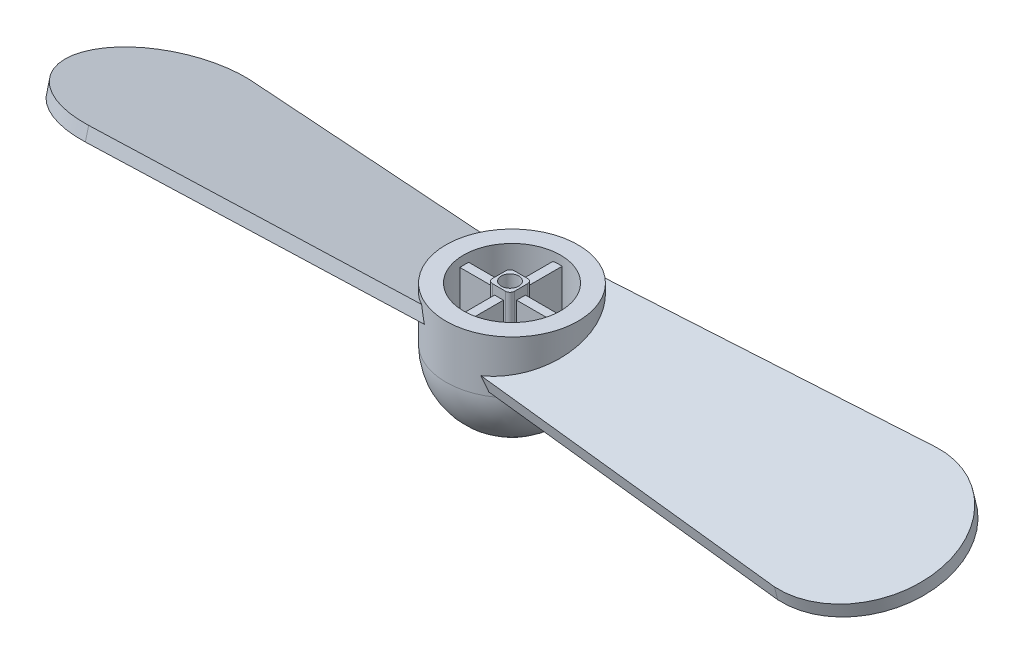
from build123d import *

# Parameters (mm, degrees)
SKETCH_1_R               = 7.5
EXTRUDE_1_DEPTH          = 6
EXTRUDE_2_DEPTH          = 50
EXTRUDE_3_DEPTH          = 1.5
CUT_EXTRUDE_START        = -1.5
CUT_EXTRUDE_2_DEPTH      = 1.475557967
PATTERN_CIRCULAR_1_COUNT = 2
REVOLVE_1_ANGLE          = 180
EXTRUDE_5_REACH          = 54.77
SKETCH_8_W               = 2.5
SKETCH_8_H               = 2.5
EXTRUDE_6_REACH          = 55.77
EXTRUDE_START            = -1
SKETCH_14_W              = 6.185620564
SKETCH_14_H              = 1
EXTRUDE_7_REACH          = 54.523
SKETCH_15_W              = 1
SKETCH_15_H              = 5.873847005
FILLET_1_R               = 0.5
SKETCH_16_R              = 1
CUT_EXTRUDE_5_DEPTH      = 7


# Read off the part's stored shape, not the designer's step: 切除-拉伸2, 抽壳9
with BuildPart() as part:
    # 草图1 → 凸台-拉伸1 (new body)
    with BuildSketch(Plane(origin=(0, 0, 0), x_dir=(1, 0, 0), z_dir=(0, 1, 0))):
        with Locations(Location((0.301002806, -0.075250701, 0), (0, 0, 270))):
            Circle(SKETCH_1_R)
    extrude(amount=EXTRUDE_1_DEPTH)

    # 草图2 → 凸台-拉伸2 (add)
    with BuildSketch(Plane(origin=(0, 0, 0), x_dir=(0, 0, -1), z_dir=(1, 0, 0))):
        Polygon((-6.841656071, 1.896781733), (-6.217832024, 0.532654335), (6.742880936, 3.816427212), (6.11905689, 5.18055461), align=None)
    extrude(amount=EXTRUDE_2_DEPTH)

    # 草图3 → 凸台-拉伸3 (add)
    with BuildSketch(Plane(origin=(0, 3.411230811, 0.864281714), x_dir=(1, 0, 0), z_dir=(0, 0.9693704528417939, 0.24560318637447578))):
        with BuildLine():
            Line((3.425595735, 7.47367623), (3.536085243, -6.166243606))
            Line((3.536085243, -6.166243606), (40.104138222, -9.535908549))
            ThreePointArc((40.104138222, -9.535908549), (50, -0.119655983), (40.104138222, 9.296596584))
            Line((40.104138222, 9.296596584), (3.425595735, 7.47367623))
        make_face()
    extrude_3 = extrude(amount=-EXTRUDE_3_DEPTH)

    # 切除-拉伸2 outline → 切除-拉伸2 (cut)
    with BuildSketch(Plane(origin=(0, 1.957175132, 0.495876935), x_dir=(1, 0, 0), z_dir=(0, -0.9693704528417938, -0.24560318637447576)).offset(CUT_EXTRUDE_START)):
        with BuildLine():
            Line((59.770521771, 9.535908549), (41.04011208, 9.535908549))
            ThreePointArc((41.04011208, 9.535908549), (47.402093905, 6.618605973), (50, 0.119655983))
            ThreePointArc((50, 0.119655983), (47.402093905, -6.379294008), (41.040112081, -9.296596584))
            Line((41.040112081, -9.296596584), (60.303287448, -9.296596584))
            Line((60.303287448, -9.296596584), (59.770521771, 9.535908549))
        make_face()
    extrude(amount=CUT_EXTRUDE_2_DEPTH, mode=Mode.SUBTRACT)

    # 阵列(圆周)1: 凸台-拉伸3 ×2 about axis
    pattern_circular_1_axis = Axis((0.301002806, 0, 0.075250701), (0, 1, 0))
    for i in range(1, PATTERN_CIRCULAR_1_COUNT):
        add(extrude_3.rotate(pattern_circular_1_axis, i * 360 / PATTERN_CIRCULAR_1_COUNT))

    # 草图6 → 旋转1 (revolve)
    with BuildSketch(Plane(origin=(0, 0, 0), x_dir=(1, 0, 0), z_dir=(0, 1, 0))):
        with BuildLine():
            Line((7.577071557, -1.894267889), (-6.975065945, 1.743766486))
            ThreePointArc((-6.975065945, 1.743766486), (2.120019994, 7.20081805), (7.577071557, -1.894267889))
        make_face()
    revolve(axis=Axis((7.577071557, 0, 1.894267889), (-0.9701425001453376, 0, -0.2425356250363098)), revolution_arc=REVOLVE_1_ANGLE)

    # 抽壳9 outline → 抽壳9 (revolve, cut)
    with BuildSketch(Plane(origin=(0.301002806, 0, 0.075250701), x_dir=(1, 0, 0), z_dir=(0, 0, 1))):
        with BuildLine():
            Line((5.5, 6e-09), (5.5, 6))
            Line((5.5, 6), (0, 6))
            Line((0, 6), (0, -5.5))
            ThreePointArc((0, -5.5), (3.889087299, -3.889087294), (5.5, 6e-09))
        make_face()
    revolve(axis=Axis((0.301002806, 0, 0.075250701), (0, 1, 0)), mode=Mode.SUBTRACT)

    # 草图8 → 凸台-拉伸5 (add, up to next)
    with BuildSketch(Plane(origin=(0, 6, 0), x_dir=(1, 0, 0), z_dir=(0, 1, 0)), mode=Mode.PRIVATE) as extrude_5_sk1:
        Rectangle(SKETCH_8_W, SKETCH_8_H)
    extrude_5_tool1 = extrude(extrude_5_sk1.sketch, amount=-EXTRUDE_5_REACH, mode=Mode.PRIVATE) - part.part
    add(extrude_5_tool1.solids().sort_by_distance((0, 6, 0))[0])

    # 草图14 → 凸台-拉伸6 (add, up to next)
    with BuildSketch(Plane(origin=(0, 6, 0), x_dir=(1, 0, 0), z_dir=(0, 1, 0)).offset(EXTRUDE_START), mode=Mode.PRIVATE) as extrude_6_sk1:
        with Locations((3.092810282, 0)):
            Rectangle(SKETCH_14_W, SKETCH_14_H)
    extrude_6_tool1 = extrude(extrude_6_sk1.sketch, amount=-EXTRUDE_6_REACH, mode=Mode.PRIVATE) - part.part
    extrude_6 = extrude_6_tool1.solids().sort_by_distance((3.09281, 5, 0))[0]
    add(extrude_6)

    # 镜向1: 凸台-拉伸6 across plane
    add(extrude_6.mirror(Plane(origin=(0, 0, 0), x_dir=(0, 0, 1), z_dir=(1, 0, 0))))

    # 草图15 → 凸台-拉伸7 (add, up to next)
    with BuildSketch(Plane(origin=(0, 5, 0), x_dir=(1, 0, 0), z_dir=(0, 1, 0)), mode=Mode.PRIVATE) as extrude_7_sk1:
        with Locations((0, 2.936923503)):
            Rectangle(SKETCH_15_W, SKETCH_15_H)
    extrude_7_tool1 = extrude(extrude_7_sk1.sketch, amount=-EXTRUDE_7_REACH, mode=Mode.PRIVATE) - part.part
    extrude_7 = extrude_7_tool1.solids().sort_by_distance((0, 5, -2.936924))[0]
    add(extrude_7)

    # 镜向2: 凸台-拉伸7 mirrored; each copy of 凸台-拉伸7 runs up to whatever stops it at its own place
    mirror_2_before = part.part  # the part as the pattern finds it: every copy runs up to it
    mirror_2_extrude_7_long = extrude(extrude_7_sk1.sketch, amount=-EXTRUDE_7_REACH, mode=Mode.PRIVATE)
    mirror_2_extrude_7_tool1 = mirror_2_extrude_7_long.mirror(Plane.XY) - mirror_2_before
    add(mirror_2_extrude_7_tool1.solids().sort_by_distance((0, 5, 2.936924))[0])

    # 圆角1
    fillet_1_edges = [part.edges().sort_by_distance(p)[0] for p in [
        (-1.25, 0.427824152, 1.25),
        (1.25, 0.355696292, 1.25),
        (1.25, 0.373542552, -1.25),
        (-1.25, 0.446174395, -1.25),
    ]]
    fillet(fillet_1_edges, radius=FILLET_1_R)

    # 草图16 → 切除-拉伸5 (cut)
    with BuildSketch(Plane(origin=(0, 6, 0), x_dir=(1, 0, 0), z_dir=(0, 1, 0))):
        with Locations(Location((0, 0, 0), (0, 0, 270))):
            Circle(SKETCH_16_R)
    extrude(amount=-CUT_EXTRUDE_5_DEPTH, mode=Mode.SUBTRACT)


solid = part.part
